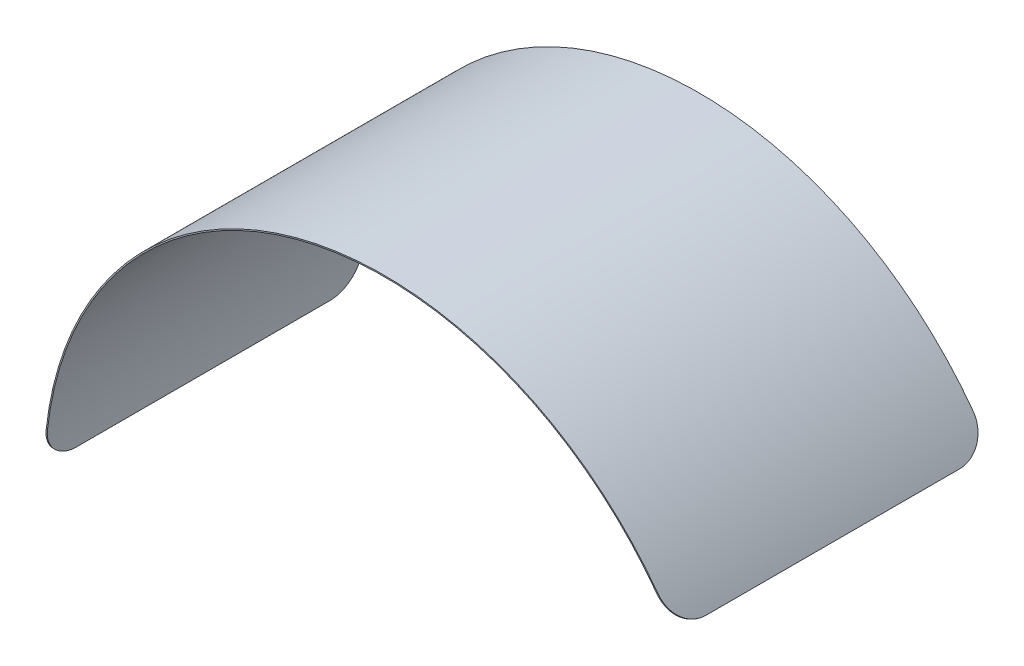
from build123d import *

# Parameters (mm, degrees)
BOSS_EXTRUDE1_DEPTH = 1018.2
FILLET1_START       = -1
FILLET1_DEPTH       = 10
FILLET1_START_2     = 2027
FILLET1_2_DEPTH     = 11


with BuildPart() as part:
    # Sketch1 → Boss-Extrude1 (new body)
    with BuildSketch(Plane.XY):
        with BuildLine():
            Line((2036.872393674, 565.728630714), (2033.445329339, 563.665809819))
            ThreePointArc((2033.445329339, 563.665809819), (814.110783703, 1055.756928134), (4.181650628, 19.926245878))
            Line((4.181650628, 19.926245878), (0.182315406, 19.99916901))
            ThreePointArc((0.182315406, 19.99916901), (813.075507523, 1059.620631439), (2036.872393674, 565.728630714))
        make_face()
    extrude(amount=BOSS_EXTRUDE1_DEPTH)

    # Fillet1: read off the stored shape, not the designer's step
    # Fillet1 outline → Fillet1 (cut)
    with BuildSketch(Plane(origin=(0, 0, 0), x_dir=(0.018230783053814693, 0.9998338054643106, 0), z_dir=(0.9998338054643106, -0.018230783053814693, 0)).offset(FILLET1_START)):
        with BuildLine():
            ThreePointArc((119.99916901, 0), (49.288490891, 29.289321881), (19.99916901, 100))
            Line((19.99916901, 100), (19.99916901, 0))
            Line((19.99916901, 0), (119.99916901, 0))
        make_face()
        with BuildLine():
            ThreePointArc((19.99916901, 918.2), (49.288490891, 988.910678119), (119.99916901, 1018.2))
            Line((119.99916901, 1018.2), (19.99916901, 1018.2))
            Line((19.99916901, 1018.2), (19.99916901, 918.2))
        make_face()
    extrude(amount=FILLET1_DEPTH, mode=Mode.SUBTRACT)

    # Fillet1 2 outline → Fillet1 2 (cut)
    with BuildSketch(Plane(origin=(0, 0, 0), x_dir=(0.5157052239876767, -0.8567660835676328, 0), z_dir=(0.8567660835676328, 0.515705223987677, 0)).offset(FILLET1_START_2)):
        with BuildLine():
            Line((565.728630715, 0), (465.728630715, 0))
            ThreePointArc((465.728630715, 0), (536.439308834, -29.289321881), (565.728630715, -100))
            Line((565.728630715, -100), (565.728630715, 0))
        make_face()
        with BuildLine():
            Line((565.728630715, -1018.2), (565.728630715, -918.2))
            ThreePointArc((565.728630715, -918.2), (536.439308834, -988.910678119), (465.728630715, -1018.2))
            Line((465.728630715, -1018.2), (565.728630715, -1018.2))
        make_face()
    extrude(amount=FILLET1_2_DEPTH, mode=Mode.SUBTRACT)


solid = part.part
